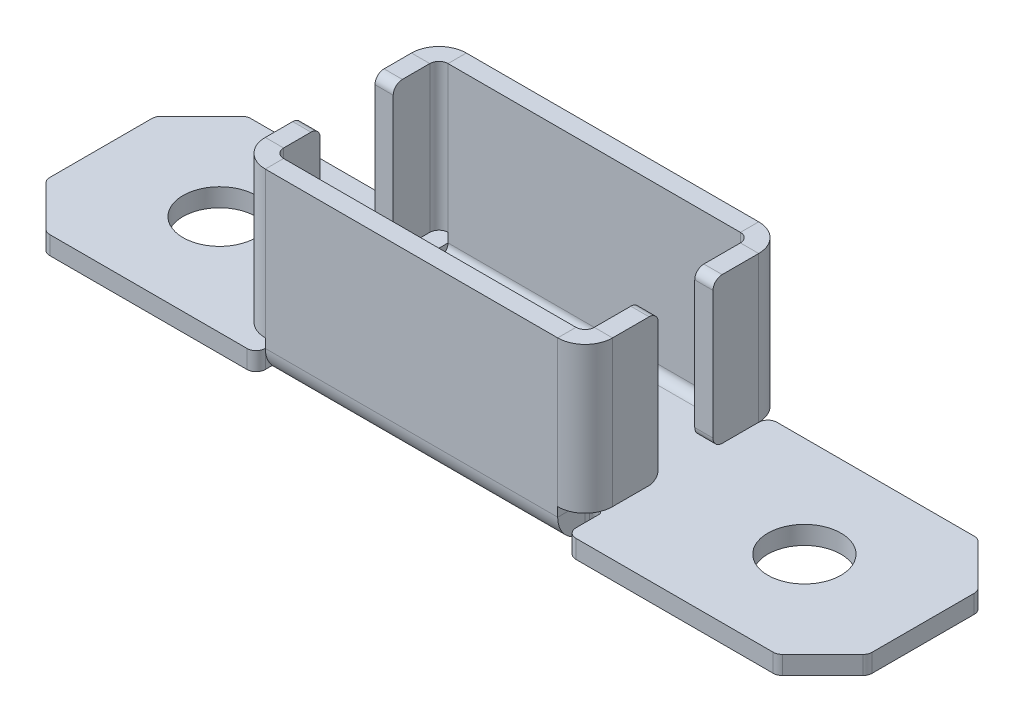
from build123d import *

# Parameters (mm, degrees)
SKETCH1_W                     = 90
SKETCH1_H                     = 22
BASE_FLANGE1_DEPTH            = 2
EDGE_FLANGE4_STRIP_W          = 10
EDGE_FLANGE4_STRIP_H          = 2
EDGE_FLANGE4_STRIP_CUT_DEPTH  = 32
EDGE_FLANGE4_RELIEF_W         = 11
EDGE_FLANGE4_RELIEF_H         = 1
EDGE_FLANGE4_RELIEF_CUT_DEPTH = 2
EDGE_FLANGE4_DEPTH            = 32
EDGE_FLANGE8_DEPTH            = 16
EDGE_FLANGE9_DEPTH            = 16
FILLET2_R                     = 1
FILLET4_R                     = 1
FILLET5_R                     = 1
FILLET7_R                     = 0.5
FILLET8_R                     = 0.5
FILLET9_R                     = 0.5
FILLET10_R                    = 1
BREAK_CORNER2_START           = -39.597979746
BREAK_CORNER2_OUTLINE_W       = 72.124891682
BREAK_CORNER2_OUTLINE_H       = 4
BREAK_CORNER2_DEPTH           = 3.535533905
BREAK_CORNER2_START_2         = 36.062445841
BREAK_CORNER2_2_OUTLINE_W     = 72.124891682
BREAK_CORNER2_2_OUTLINE_H     = 4
BREAK_CORNER2_2_DEPTH         = 3.535533905
BREAK_CORNER2_START_3         = -27.577164466
BREAK_CORNER2_3_OUTLINE_W     = 3.937554159
BREAK_CORNER2_3_OUTLINE_H     = 4
BREAK_CORNER2_3_DEPTH         = 55.154328932
FILLET11_R                    = 1
FILLET12_R                    = 0.5
FILLET13_R                    = 1
SKETCH62_R                    = 4
CUT_EXTRUDE2_DEPTH            = 10
SKETCH63_R                    = 4
CUT_EXTRUDE3_DEPTH            = 10


# Read off the part's stored shape, not the designer's step: Break-Corner2
# Sheet-metal steps are written as plain solids
with BuildPart() as part:
    # Sketch1 → Base-Flange1 (new body)
    with BuildSketch(Plane(origin=(0, 0, 0), x_dir=(1, 0, 0), z_dir=(0, 1, 0))):
        Rectangle(SKETCH1_W, SKETCH1_H)
    extrude(amount=-BASE_FLANGE1_DEPTH)

    # Edge-Flange4 strip (across the edge) → Edge-Flange4 strip cut (cut)
    with BuildSketch(Plane(origin=(-16, 0, 11), x_dir=(0, 0, -1), z_dir=(1, 0, 0))):
        with Locations((-2, -1)):
            Rectangle(EDGE_FLANGE4_STRIP_W, EDGE_FLANGE4_STRIP_H)
    edge_flange4_strip_cut = extrude(amount=EDGE_FLANGE4_STRIP_CUT_DEPTH, mode=Mode.SUBTRACT)

    # Edge-Flange4 relief (on the sheet) → Edge-Flange4 relief cut (cut)
    with BuildSketch(Plane(origin=(-16, 0, 8), x_dir=(0, 0, -1), z_dir=(0, 1, 0))):
        with Locations((-4.5, 0.5)):
            Rectangle(EDGE_FLANGE4_RELIEF_W, EDGE_FLANGE4_RELIEF_H)
        with Locations((-4.5, -32.5)):
            Rectangle(EDGE_FLANGE4_RELIEF_W, EDGE_FLANGE4_RELIEF_H)
    edge_flange4_relief_cut = extrude(amount=-EDGE_FLANGE4_RELIEF_CUT_DEPTH, mode=Mode.SUBTRACT)

    # Edge-Flange4 section (across the edge) → Edge-Flange4 (add)
    with BuildSketch(Plane(origin=(-16, 0, 11), x_dir=(0, 0, -1), z_dir=(1, 0, 0))):
        with BuildLine():
            Line((0, 1), (0, 18))
            Line((0, 18), (2, 18))
            Line((2, 18), (2, 1))
            ThreePointArc((2, 1), (2.292893219, 0.292893219), (3, 0))
            Line((3, 0), (3, -2))
            ThreePointArc((3, -2), (0.878679656, -1.121320344), (0, 1))
        make_face()
    edge_flange4 = extrude(amount=EDGE_FLANGE4_DEPTH)

    # Edge-Flange8 section (across the edge) → Edge-Flange8 (add)
    with BuildSketch(Plane(origin=(17, 18, 9), x_dir=(-1, 0, 0), z_dir=(0, -1, 0))):
        with BuildLine():
            Line((-2, 1), (-2, 6))
            Line((-2, 6), (0, 6))
            Line((0, 6), (0, 1))
            ThreePointArc((0, 1), (0.292893219, 0.292893219), (1, 0))
            Line((1, 0), (1, -2))
            ThreePointArc((1, -2), (-1.121320344, -1.121320344), (-2, 1))
        make_face()
    edge_flange8 = extrude(amount=EDGE_FLANGE8_DEPTH)

    # Edge-Flange9 section (across the edge) → Edge-Flange9 (add)
    with BuildSketch(Plane(origin=(-17, 2, 9), x_dir=(1, 0, 0), z_dir=(0, 1, 0))):
        with BuildLine():
            Line((-2, 1), (-2, 5))
            Line((-2, 5), (0, 5))
            Line((0, 5), (0, 1))
            ThreePointArc((0, 1), (0.292893219, 0.292893219), (1, 0))
            Line((1, 0), (1, -2))
            ThreePointArc((1, -2), (-1.121320344, -1.121320344), (-2, 1))
        make_face()
    edge_flange9 = extrude(amount=EDGE_FLANGE9_DEPTH)

    # Fillet2
    fillet2_edges = [part.edges().sort_by_distance(p)[0] for p in [
        (18, 2, 3),
    ]]
    fillet(fillet2_edges, radius=FILLET2_R)

    # Fillet4
    fillet4_edges = [part.edges().sort_by_distance(p)[0] for p in [
        (-18, 18, 4),
        (18, 18, 3),
    ]]
    fillet(fillet4_edges, radius=FILLET4_R)

    # Fillet5
    fillet5_edges = [part.edges().sort_by_distance(p)[0] for p in [
        (-18, 2, 4),
    ]]
    fillet(fillet5_edges, radius=FILLET5_R)

    # Fillet7
    fillet7_edges = [part.edges().sort_by_distance(p)[0] for p in [
        (16, -1, 7),
    ]]
    fillet(fillet7_edges, radius=FILLET7_R)

    # Fillet8
    fillet8_edges = [part.edges().sort_by_distance(p)[0] for p in [
        (17, -1, 7),
    ]]
    fillet(fillet8_edges, radius=FILLET8_R - 0.0001)  # a hair under: the kernel refuses the full size

    # Fillet9
    fillet9_edges = [part.edges().sort_by_distance(p)[0] for p in [
        (-16, -1, 7),
        (-17, -1, 7),
    ]]
    fillet(fillet9_edges, radius=FILLET9_R - 0.0001)  # a hair under: the kernel refuses the full size

    # Fillet10
    fillet10_edges = [part.edges().sort_by_distance(p)[0] for p in [
        (17, -1, 11),
        (-17, -1, 11),
    ]]
    fillet(fillet10_edges, radius=FILLET10_R)

    # Break-Corner2 outline → Break-Corner2 (cut)
    with BuildSketch(Plane(origin=(0, 0, 0), x_dir=(0.7071067811865471, 0, -0.707106781186548), z_dir=(0.707106781186548, 0, 0.707106781186547)).offset(BREAK_CORNER2_START)):
        with Locations((0, -1)):
            Rectangle(BREAK_CORNER2_OUTLINE_W, BREAK_CORNER2_OUTLINE_H)
    extrude(amount=BREAK_CORNER2_DEPTH, mode=Mode.SUBTRACT)

    # Break-Corner2 2 outline → Break-Corner2 2 (cut)
    with BuildSketch(Plane(origin=(0, 0, 0), x_dir=(0.7071067811865471, 0, -0.707106781186548), z_dir=(0.707106781186548, 0, 0.707106781186547)).offset(BREAK_CORNER2_START_2)):
        with Locations((0, -1)):
            Rectangle(BREAK_CORNER2_2_OUTLINE_W, BREAK_CORNER2_2_OUTLINE_H)
    extrude(amount=BREAK_CORNER2_2_DEPTH, mode=Mode.SUBTRACT)

    # Break-Corner2 3 outline → Break-Corner2 3 (cut)
    with BuildSketch(Plane(origin=(0, 0, 0), x_dir=(0.7071067811865471, 0, -0.707106781186548), z_dir=(0.707106781186548, 0, 0.707106781186547)).offset(BREAK_CORNER2_START_3)):
        with Locations((38.03122292, -1)):
            Rectangle(BREAK_CORNER2_3_OUTLINE_W, BREAK_CORNER2_3_OUTLINE_H)
        with Locations((-38.03122292, -1)):
            Rectangle(BREAK_CORNER2_3_OUTLINE_W, BREAK_CORNER2_3_OUTLINE_H)
    extrude(amount=BREAK_CORNER2_3_DEPTH, mode=Mode.SUBTRACT)

    # Mirror1: Edge-Flange4 strip cut, Edge-Flange4 relief cut, Edge-Flange4, Edge-Flange8, Edge-Flange9 across plane
    add(edge_flange4_strip_cut.mirror(Plane.XY), mode=Mode.SUBTRACT)
    add(edge_flange4_relief_cut.mirror(Plane.XY), mode=Mode.SUBTRACT)
    add(edge_flange4.mirror(Plane.XY))
    add(edge_flange8.mirror(Plane.XY))
    add(edge_flange9.mirror(Plane.XY))

    # Fillet11
    fillet11_edges = [part.edges().sort_by_distance(p)[0] for p in [
        (17, -1, -11),
        (-17, -1, -11),
        (-18, 2, -4),
        (-18, 18, -4),
        (18, 2, -3),
        (18, 18, -3),
    ]]
    fillet(fillet11_edges, radius=FILLET11_R)

    # Fillet12
    fillet12_edges = [part.edges().sort_by_distance(p)[0] for p in [
        (-17, -1, -7),
        (-16, -1, -7),
        (16, -1, -7),
        (17, -1, -7),
    ]]
    fillet(fillet12_edges, radius=FILLET12_R - 0.0001)  # a hair under: the kernel refuses the full size

    # Fillet13
    fillet13_edges = [part.edges().sort_by_distance(p)[0] for p in [
        (40.000000001, -1, 11),
        (45, -1, 6.000000001),
        (45, -1, -6.000000001),
        (40.000000001, -1, -11),
        (-40.000000001, -1, -11),
        (-45, -1, -6.000000001),
        (-45, -1, 6.000000001),
        (-40.000000001, -1, 11),
    ]]
    fillet(fillet13_edges, radius=FILLET13_R)

    # Sketch62 → Cut-Extrude2 (cut)
    with BuildSketch(Plane(origin=(0, 0, 0), x_dir=(1, 0, 0), z_dir=(0, 1, 0))):
        with Locations(Location((-32, 0, 0), (0, 0, 270))):
            Circle(SKETCH62_R)
    extrude(amount=-CUT_EXTRUDE2_DEPTH, mode=Mode.SUBTRACT)

    # Sketch63 → Cut-Extrude3 (cut)
    with BuildSketch(Plane(origin=(0, 0, 0), x_dir=(1, 0, 0), z_dir=(0, 1, 0))):
        with Locations(Location((32, 0, 0), (0, 0, 270))):
            Circle(SKETCH63_R)
    extrude(amount=-CUT_EXTRUDE3_DEPTH, mode=Mode.SUBTRACT)


solid = part.part
